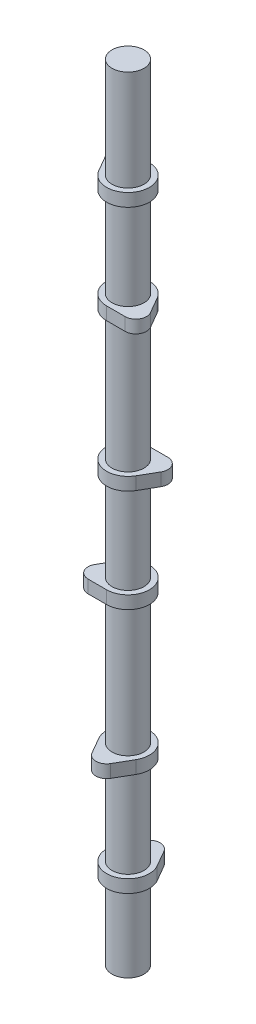
from build123d import *

# Parameters (mm, degrees)
BOSS_EXTRUDE1_DEPTH   = 3.81
LPATTERN1_COUNT       = 2
LPATTERN1_PITCH       = 60.96
BODY_MOVE_COPY1_ANGLE = 180
LPATTERN2_COUNT       = 3
LPATTERN2_PITCH       = 146.05
BODY_MOVE_COPY2_ANGLE = 120
BODY_MOVE_COPY3_ANGLE = 120
BOSS_EXTRUDE2_START   = -49.53
SKETCH5_R             = 9.5
BOSS_EXTRUDE2_DEPTH   = 466.09


with BuildPart() as part:
    # Sketch2 → Boss-Extrude1 (new, symmetric)
    with BuildSketch(Plane(origin=(0, 0, 0), x_dir=(1, 0, 0), z_dir=(0, 1, 0))):
        with BuildLine():
            Line((-5.499261314, 15.875), (-10.998522628, 6.35))
            ThreePointArc((-10.998522628, 6.35), (0, -12.7), (10.998522628, 6.35))
            Line((10.998522628, 6.35), (5.499261314, 15.875))
            ThreePointArc((5.499261314, 15.875), (0, 19.05), (-5.499261314, 15.875))
        make_face()
    extrude(amount=BOSS_EXTRUDE1_DEPTH, both=True)


with BuildPart() as lpattern1_1:
    # LPattern1: pattern copy
    add(part.part.moved(Location(Vector(0, 1, 0) * (1 * LPATTERN1_PITCH))))


with BuildPart() as lpattern1_1_1:
    # Body-Move/Copy1: moved
    add(lpattern1_1.part.rotate(Axis((0, 0, 0), (0, 1, 0)), BODY_MOVE_COPY1_ANGLE))


with BuildPart() as lpattern2_1:
    # LPattern2: pattern copy
    add(part.part.moved(Location(Vector(0, 1, 0) * (1 * LPATTERN2_PITCH))))


with BuildPart() as lpattern2_2:
    # LPattern2: pattern copy
    add(part.part.moved(Location(Vector(0, 1, 0) * (2 * LPATTERN2_PITCH))))


with BuildPart() as lpattern2_3:
    # LPattern2: pattern copy
    add(lpattern1_1_1.part.moved(Location(Vector(0, 1, 0) * (1 * LPATTERN2_PITCH))))


with BuildPart() as lpattern2_4:
    # LPattern2: pattern copy
    add(lpattern1_1_1.part.moved(Location(Vector(0, 1, 0) * (2 * LPATTERN2_PITCH))))


with BuildPart() as lpattern2_1_1:
    # Body-Move/Copy2: moved
    add(lpattern2_1.part.rotate(Axis((0, 0, 0), (0, 1, 0)), BODY_MOVE_COPY2_ANGLE))


with BuildPart() as lpattern2_3_1:
    # Body-Move/Copy2: moved
    add(lpattern2_3.part.rotate(Axis((0, 0, 0), (0, 1, 0)), BODY_MOVE_COPY2_ANGLE))


with BuildPart() as lpattern2_4_1:
    # Body-Move/Copy3: moved
    add(lpattern2_4.part.rotate(Axis((0, 0, 0), (0, -1, 0)), BODY_MOVE_COPY3_ANGLE))


with BuildPart() as lpattern2_2_1:
    # Body-Move/Copy3: moved
    add(lpattern2_2.part.rotate(Axis((0, 0, 0), (0, -1, 0)), BODY_MOVE_COPY3_ANGLE))


with BuildPart() as part_1:
    add(part.part)

    add(lpattern1_1_1.part)  # Boss-Extrude2 merges LPattern1_1

    add(lpattern2_1_1.part)  # Boss-Extrude2 merges LPattern2_1

    add(lpattern2_2_1.part)  # Boss-Extrude2 merges LPattern2_2

    add(lpattern2_3_1.part)  # Boss-Extrude2 merges LPattern2_3

    add(lpattern2_4_1.part)  # Boss-Extrude2 merges LPattern2_4
    # Sketch5 → Boss-Extrude2 (add)
    with BuildSketch(Plane(origin=(0, 0, 0), x_dir=(1, 0, 0), z_dir=(0, 1, 0)).offset(BOSS_EXTRUDE2_START)):
        Circle(SKETCH5_R)
    extrude(amount=BOSS_EXTRUDE2_DEPTH)


solid = part_1.part
